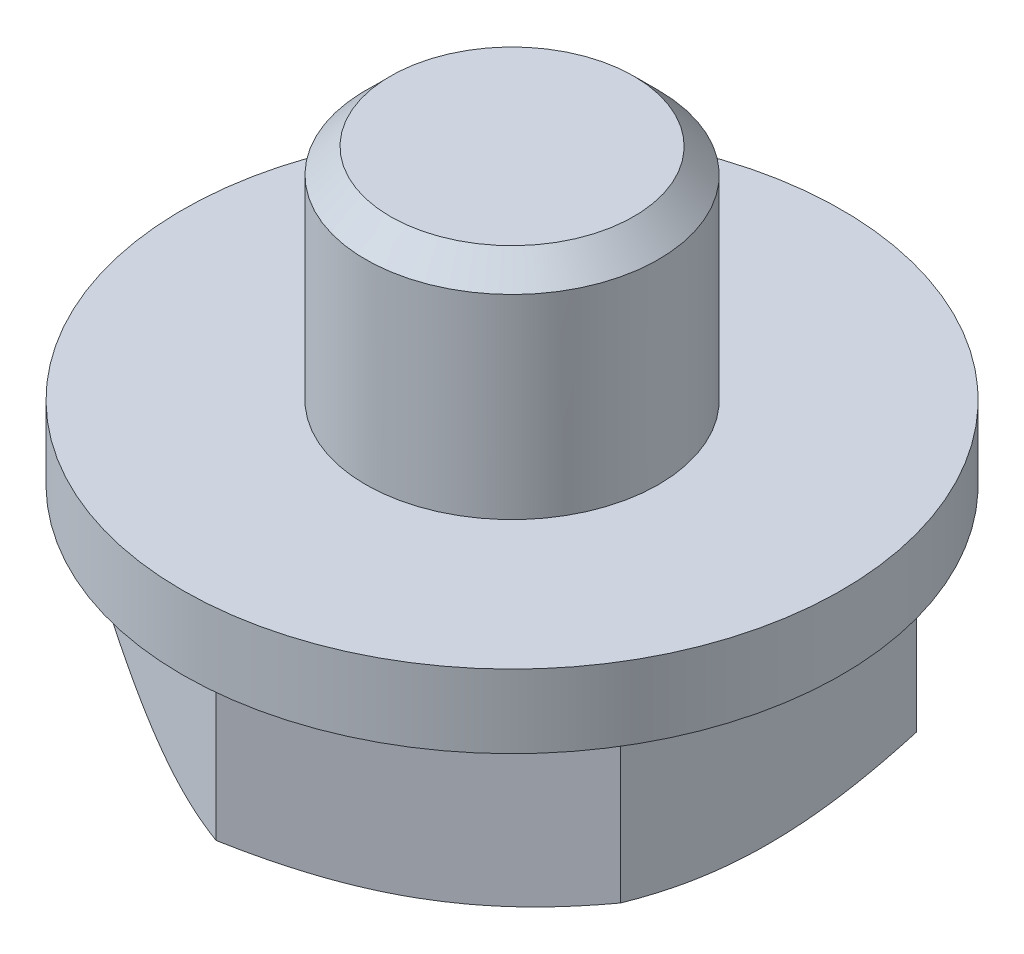
from build123d import *

# Parameters (mm, degrees)
EXTRUDE_1_DEPTH     = 5
SKETCH_3_OUTSIDE_W  = 64.746
SKETCH_3_OUTSIDE_H  = 66.912
SKETCH_3_OUTSIDE_R  = 7
CUT_EXTRUDE_1_DEPTH = 12.80395414
CUT_EXTRUDE_1_DRAFT = -60
SKETCH_4_R          = 9
EXTRUDE_2_DEPTH     = 2
SKETCH_5_R          = 4
EXTRUDE_3_DEPTH     = 6


# Read off the part's stored shape, not the designer's step: M8 机械螺纹 螺柱1
with BuildPart() as part:
    # 草图1 → 凸台-拉伸1 (new body)
    with BuildSketch(Plane(origin=(0, 0, 0), x_dir=(1, 0, 0), z_dir=(0, 1, 0))):
        Polygon((7, -4.041451884), (7, 4.041451884), (0, 8.082903769), (-7, 4.041451884), (-7, -4.041451884), (0, -8.082903769), align=None)
    extrude(amount=EXTRUDE_1_DEPTH)


with BuildPart() as cut_extrude_1_tool:
    # 草图3 outside → 切除-拉伸1 (with draft: the straight prism first)
    with BuildSketch(Plane.XZ):
        Rectangle(SKETCH_3_OUTSIDE_W, SKETCH_3_OUTSIDE_H)
        Circle(SKETCH_3_OUTSIDE_R, mode=Mode.SUBTRACT)
    extrude(amount=-CUT_EXTRUDE_1_DEPTH)
    # 切除-拉伸1: the draft: its side faces are tilted about the plane it starts from
    cut_extrude_1_sides = [cut_extrude_1_tool.faces().sort_by_distance(p)[0] for p in [
        (0, 6.40197707, -33.456),
        (32.373, 6.40197707, 0),
        (0, 6.40197707, 33.456),
        (-32.373, 6.40197707, 0),
        (-7, 6.40197707, 0),
    ]]
    draft(cut_extrude_1_sides, Plane.XZ, CUT_EXTRUDE_1_DRAFT)


with BuildPart() as part_1:
    add(part.part)

    # 切除-拉伸1: cut by cut_extrude_1_tool
    add(cut_extrude_1_tool.part, mode=Mode.SUBTRACT)

    # 草图4 → 凸台-拉伸2 (add)
    with BuildSketch(Plane(origin=(0, 5, 0), x_dir=(1, 0, 0), z_dir=(0, 1, 0))):
        with Locations(Location((0, 0, 0), (0, 0, 270))):
            Circle(SKETCH_4_R)
    extrude(amount=EXTRUDE_2_DEPTH)

    # 草图5 → 凸台-拉伸3 (add)
    with BuildSketch(Plane(origin=(0, 7, 0), x_dir=(1, 0, 0), z_dir=(0, 1, 0))):
        with Locations(Location((0, 0, 0), (0, 0, 270))):
            Circle(SKETCH_5_R)
    extrude(amount=EXTRUDE_3_DEPTH)

    # M8 机械螺纹 螺柱1 outline → M8 机械螺纹 螺柱1 (revolve, cut)
    with BuildSketch(Plane.XY):
        Polygon((4, 13), (3.3235, 13), (4, 12.3235), align=None)
    revolve(axis=Axis((0, 0, 0), (0, 1, 0)), mode=Mode.SUBTRACT)


solid = part_1.part
